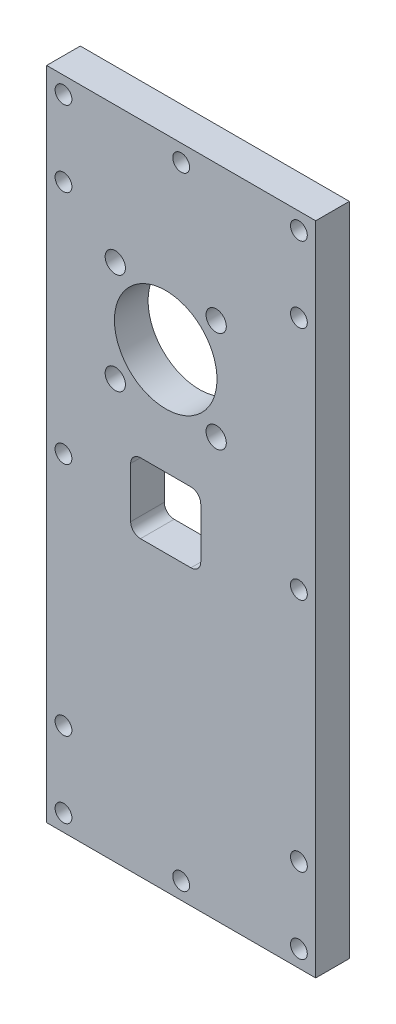
from build123d import *

# Parameters (mm, degrees)
SKIZZE1_W                       = 80
SKIZZE1_H                       = 195
AUFSATZ_LINEAR_AUSTRAGEN1_DEPTH = 10
SKIZZE2_R                       = 3.015
SKIZZE2_R_2                     = 15.25
SCHNITT_LINEAR_AUSTRAGEN1_DEPTH = 10
SKIZZE3_R                       = 1.25
SCHNITT_LINEAR_AUSTRAGEN2_DEPTH = 5
SKIZZE4_R                       = 2.5
SCHNITT_LINEAR_AUSTRAGEN3_DEPTH = 5


with BuildPart() as part:
    # Skizze1 → Aufsatz-Linear austragen1 (new body)
    with BuildSketch(Plane.XY):
        with Locations((-29.059385344, -27.400468384)):
            Rectangle(SKIZZE1_W, SKIZZE1_H)
    extrude(amount=-AUFSATZ_LINEAR_AUSTRAGEN1_DEPTH)

    # Skizze2 → Schnitt-Linear austragen1 (cut)
    with BuildSketch(Plane(origin=(0, 0, -10), x_dir=(-1, 0, 0), z_dir=(0, 0, -1))):
        with Locations((18.659385344, 29.599531616)):
            Circle(SKIZZE2_R)
        with Locations((48.659385344, 29.599531616)):
            Circle(SKIZZE2_R)
        with Locations((18.659385344, -0.400468384)):
            Circle(SKIZZE2_R)
        with Locations((48.659385344, -0.400468384)):
            Circle(SKIZZE2_R)
        with Locations((33.659385344, 14.599531616)):
            Circle(SKIZZE2_R_2)
        with BuildLine():
            Line((23.241327633, -19.900468384), (23.241327633, -34.900468384))
            ThreePointArc((23.241327633, -34.900468384), (24.096006948, -36.96384678), (26.159385344, -37.818526095))
            Line((26.159385344, -37.818526095), (41.159385344, -37.818526095))
            ThreePointArc((41.159385344, -37.818526095), (43.22276374, -36.96384678), (44.077443055, -34.900468384))
            Line((44.077443055, -34.900468384), (44.077443055, -19.900468384))
            ThreePointArc((44.077443055, -19.900468384), (43.22276374, -17.837089988), (41.159385344, -16.982410673))
            Line((41.159385344, -16.982410673), (26.159385344, -16.982410673))
            ThreePointArc((26.159385344, -16.982410673), (24.096006948, -17.837089988), (23.241327633, -19.900468384))
        make_face()
    extrude(amount=-SCHNITT_LINEAR_AUSTRAGEN1_DEPTH, mode=Mode.SUBTRACT)

    # Skizze3 → Schnitt-Linear austragen2 (cut)
    with BuildSketch(Plane(origin=(0, 0, -10), x_dir=(-1, 0, 0), z_dir=(0, 0, -1))):
        with Locations((-5.940614656, 65.099531616)):
            Circle(SKIZZE3_R)
        with Locations((63.81594416, 65.099531616)):
            Circle(SKIZZE3_R)
        with Locations((28.937664752, 65.099531616)):
            Circle(SKIZZE3_R)
        with Locations((63.81594416, 42.599531616)):
            Circle(SKIZZE3_R)
        with Locations((63.81594416, -27.400468384)):
            Circle(SKIZZE3_R)
        with Locations((63.81594416, -97.400468384)):
            Circle(SKIZZE3_R)
        with Locations((63.81594416, -119.900468384)):
            Circle(SKIZZE3_R)
        with Locations((28.937664752, -119.900468384)):
            Circle(SKIZZE3_R)
        with Locations((-5.940614656, -119.900468384)):
            Circle(SKIZZE3_R)
        with Locations((-5.940614656, -97.400468384)):
            Circle(SKIZZE3_R)
        with Locations((-5.940614656, -27.400468384)):
            Circle(SKIZZE3_R)
        with Locations((-5.940614656, 42.599531616)):
            Circle(SKIZZE3_R)
    extrude(amount=-SCHNITT_LINEAR_AUSTRAGEN2_DEPTH, mode=Mode.SUBTRACT)

    # Skizze4 → Schnitt-Linear austragen3 (cut)
    with BuildSketch(Plane.XY):
        with Locations((-64.059385344, 65.099531616)):
            Circle(SKIZZE4_R)
        with Locations((5.940614656, 65.099531616)):
            Circle(SKIZZE4_R)
        with Locations((5.940614656, 42.599531616)):
            Circle(SKIZZE4_R)
        with Locations((5.940614656, -27.400468384)):
            Circle(SKIZZE4_R)
        with Locations((5.940614656, -97.400468384)):
            Circle(SKIZZE4_R)
        with Locations((5.940614656, -119.900468384)):
            Circle(SKIZZE4_R)
        with Locations((-64.059385344, -119.900468384)):
            Circle(SKIZZE4_R)
        with Locations((-64.059385344, -97.400468384)):
            Circle(SKIZZE4_R)
        with Locations((-64.059385344, -27.400468384)):
            Circle(SKIZZE4_R)
        with Locations((-64.059385344, 42.599531616)):
            Circle(SKIZZE4_R)
        with Locations((-29.059385344, -119.900468384)):
            Circle(SKIZZE4_R)
        with Locations((-29.059385344, 65.099531616)):
            Circle(SKIZZE4_R)
    extrude(amount=-SCHNITT_LINEAR_AUSTRAGEN3_DEPTH, mode=Mode.SUBTRACT)


solid = part.part
